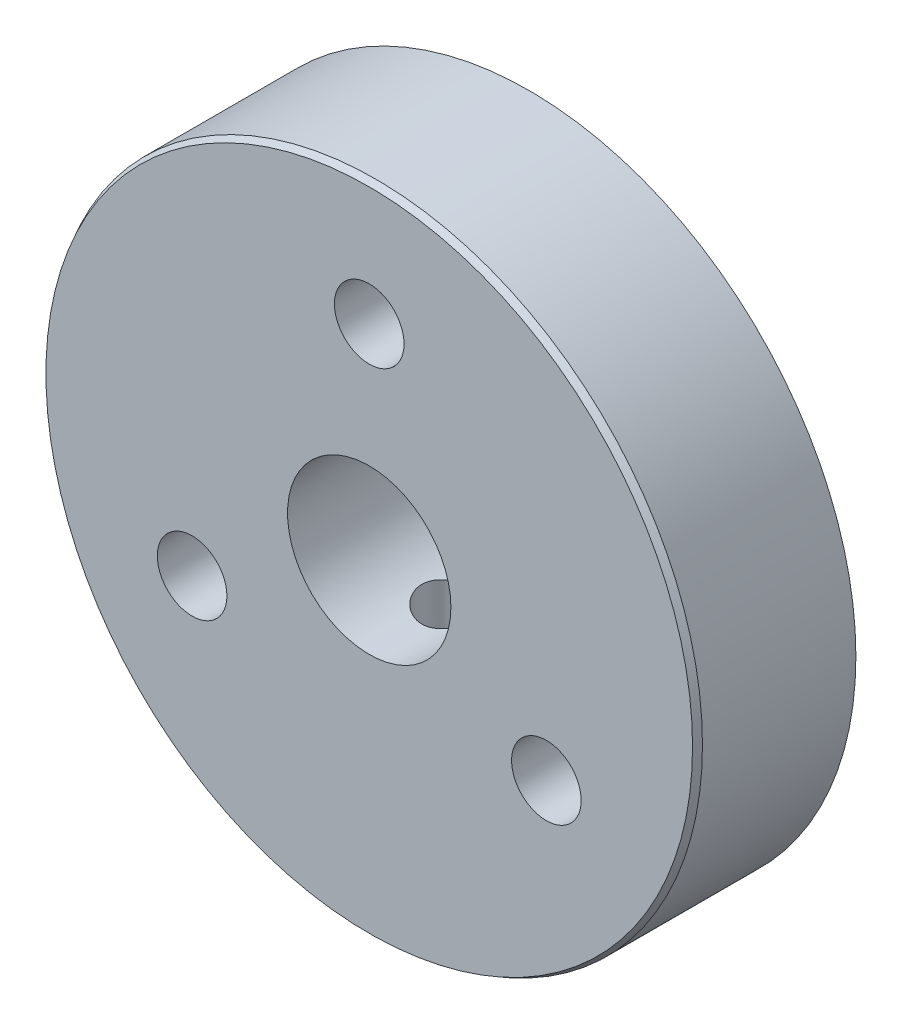
from build123d import *
from OCP.BRepFilletAPI import BRepFilletAPI_MakeChamfer

# Parameters (mm, degrees)
SKETCH2_R             = 12.7
SKETCH2_R_2           = 3.175
BOSS_EXTRUDE1_DEPTH   = 3.175
CHAMFER1_SIZE         = 0.254
CHAMFER1_SIZE2        = 0.132224031
F_6_32_TAPPED_HOLE1_D = 2.7051


# Read off the part's stored shape, not the designer's step: #4-40 Tapped Hole2
with BuildPart() as part:
    # Sketch2 → Boss-Extrude1 (new, symmetric)
    with BuildSketch(Plane.XY):
        Circle(SKETCH2_R)
        Circle(SKETCH2_R_2, mode=Mode.SUBTRACT)
    extrude(amount=BOSS_EXTRUDE1_DEPTH, both=True)

    # Chamfer1: one chamfer whose edges measure the first distance from different faces: ONE call of the kernel's chamfer builder (chamfer() names one face for all edges)
    chamfer1_edges_1 = [part.edges().sort_by_distance(p)[0] for p in [
        (-12.7, 0, -3.175),
    ]]
    chamfer1_side_1 = [part.faces().sort_by_distance(p)[0] for p in [
        (-12.340789755, 0, -3.175),
    ]]
    chamfer1_edges_2 = [part.edges().sort_by_distance(p)[0] for p in [
        (-12.7, 0, 3.175),
    ]]
    chamfer1_side_2 = [part.faces().sort_by_distance(p)[0] for p in [
        (-12.7, 0, 0),
    ]]
    chamfer1 = BRepFilletAPI_MakeChamfer(part.part.solid().wrapped)
    for e in chamfer1_edges_1:
        chamfer1.Add(CHAMFER1_SIZE, CHAMFER1_SIZE2, e.wrapped, chamfer1_side_1[0].wrapped)  # the first distance lies on this face
    for e in chamfer1_edges_2:
        chamfer1.Add(CHAMFER1_SIZE, CHAMFER1_SIZE2, e.wrapped, chamfer1_side_2[0].wrapped)  # the first distance lies on this face
    add(Compound.cast(chamfer1.Shape()), mode=Mode.REPLACE)

    # #6-32 Tapped Hole1 (through all)
    with Locations(Plane.XY.offset(3.175)):
        with Locations((0, 7.9502), (6.885075165, -3.9751), (-6.885075165, -3.9751)):
            Hole(F_6_32_TAPPED_HOLE1_D / 2)

    # #4-40 Tapped Hole2 outline → #4-40 Tapped Hole2 (revolve, cut)
    with BuildSketch(Plane.XY):
        Polygon((0, -12.700018831), (1.473216369, -12.700018831), (1.1303, -12.305538673), (1.1303, -2.966966147), (0, -2.966966147), align=None)
    revolve(axis=Axis((0, 0, 0), (0, 1, 0)), mode=Mode.SUBTRACT)


solid = part.part
